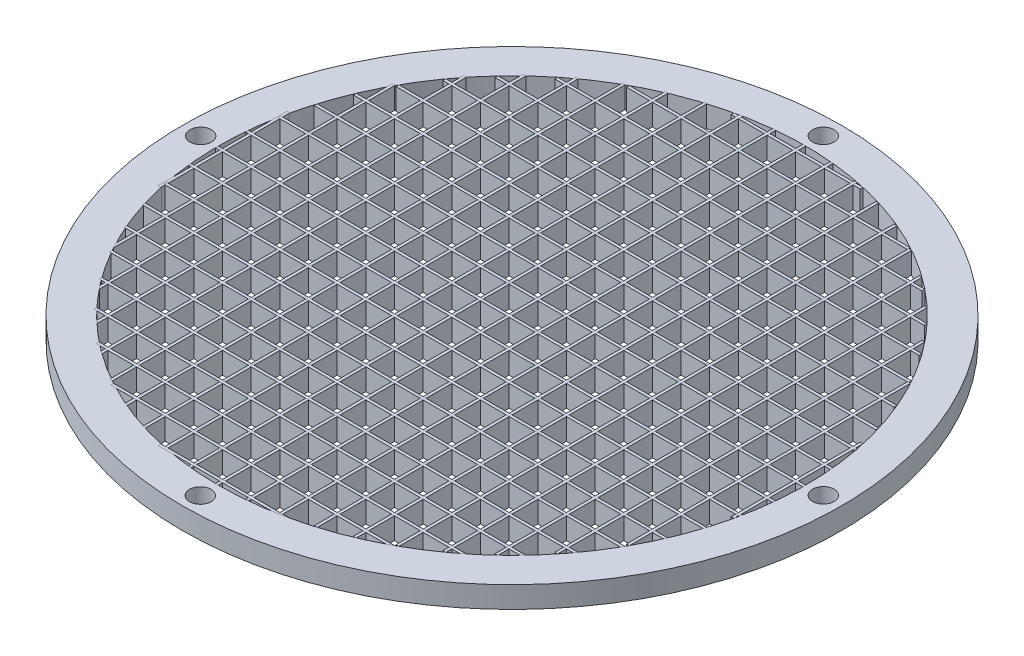
from build123d import *

# Parameters (mm, degrees)
SKETCH2_R              = 46
SKETCH2_R_2            = 41
BOSS_EXTRUDE2_DEPTH    = 3
SKETCH4_W              = 0.4
SKETCH4_H              = 82
EXTRUDE_THIN5_DEPTH    = 3
SKETCH4_H_2            = 81.608823052
EXTRUDE_THIN5_2_DEPTH  = 3
SKETCH4_H_3            = 80.423877052
EXTRUDE_THIN5_3_DEPTH  = 3
SKETCH4_H_4            = 78.409183136
EXTRUDE_THIN5_4_DEPTH  = 3
SKETCH4_H_5            = 75.498344352
EXTRUDE_THIN5_5_DEPTH  = 3
SKETCH4_H_6            = 71.582120672
EXTRUDE_THIN5_6_DEPTH  = 3
SKETCH4_H_7            = 66.483080554
EXTRUDE_THIN5_7_DEPTH  = 3
SKETCH4_H_8            = 59.899916528
EXTRUDE_THIN5_8_DEPTH  = 3
SKETCH4_H_9            = 51.264022472
EXTRUDE_THIN5_9_DEPTH  = 3
SKETCH4_H_10           = 39.24283374
EXTRUDE_THIN5_10_DEPTH = 3
SKETCH4_H_11           = 18
EXTRUDE_THIN5_11_DEPTH = 3
SKETCH4_W_2            = 82
SKETCH4_H_12           = 0.4
EXTRUDE_THIN5_12_DEPTH = 3
EXTRUDE_THIN5_13_DEPTH = 3
EXTRUDE_THIN5_14_DEPTH = 3
EXTRUDE_THIN5_15_DEPTH = 3
EXTRUDE_THIN5_16_DEPTH = 3
EXTRUDE_THIN5_17_DEPTH = 3
EXTRUDE_THIN5_18_DEPTH = 3
EXTRUDE_THIN5_19_DEPTH = 3
EXTRUDE_THIN5_20_DEPTH = 3
EXTRUDE_THIN5_21_DEPTH = 3
EXTRUDE_THIN5_22_DEPTH = 3
SKETCH4_W_3            = 81.608443304
EXTRUDE_THIN5_23_DEPTH = 3
SKETCH4_W_4            = 80.423877052
EXTRUDE_THIN5_24_DEPTH = 3
SKETCH4_W_5            = 78.409183136
EXTRUDE_THIN5_25_DEPTH = 3
SKETCH4_W_6            = 75.498344352
EXTRUDE_THIN5_26_DEPTH = 3
SKETCH4_W_7            = 71.582120672
EXTRUDE_THIN5_27_DEPTH = 3
SKETCH4_W_8            = 66.483080554
EXTRUDE_THIN5_28_DEPTH = 3
SKETCH4_W_9            = 59.899916528
EXTRUDE_THIN5_29_DEPTH = 3
SKETCH4_W_10           = 51.264022472
EXTRUDE_THIN5_30_DEPTH = 3
SKETCH4_W_11           = 39.24283374
EXTRUDE_THIN5_31_DEPTH = 3
SKETCH4_W_12           = 18
EXTRUDE_THIN5_32_DEPTH = 3
EXTRUDE_THIN5_33_DEPTH = 3
EXTRUDE_THIN5_34_DEPTH = 3
EXTRUDE_THIN5_35_DEPTH = 3
EXTRUDE_THIN5_36_DEPTH = 3
EXTRUDE_THIN5_37_DEPTH = 3
EXTRUDE_THIN5_38_DEPTH = 3
EXTRUDE_THIN5_39_DEPTH = 3
EXTRUDE_THIN5_40_DEPTH = 3
EXTRUDE_THIN5_41_DEPTH = 3
EXTRUDE_THIN5_42_DEPTH = 3
SKETCH5_R              = 1.5
CUT_EXTRUDE1_DEPTH     = 3
SKETCH6_R              = 1.5
CUT_EXTRUDE2_DEPTH     = 66.122960621


with BuildPart() as part:
    # Sketch2 → Boss-Extrude2 (new body)
    with BuildSketch(Plane(origin=(0, 0, 0), x_dir=(1, 0, 0), z_dir=(0, 1, 0))):
        Circle(SKETCH2_R)
        Circle(SKETCH2_R_2, mode=Mode.SUBTRACT)
    extrude(amount=BOSS_EXTRUDE2_DEPTH)

    # Sketch5 → Cut-Extrude1 (cut)
    with BuildSketch(Plane.XZ):
        with Locations((0, -43.452428413)):
            Circle(SKETCH5_R)
        with Locations((-43.452428413, 0)):
            Circle(SKETCH5_R)
        with Locations((43.452428413, 0)):
            Circle(SKETCH5_R)
    extrude(amount=-CUT_EXTRUDE1_DEPTH, mode=Mode.SUBTRACT)

    # Sketch6 → Cut-Extrude2 (cut, through all)
    with BuildSketch(Plane(origin=(0, 3, 0), x_dir=(1, 0, 0), z_dir=(0, 1, 0))):
        with Locations((0, -43.5)):
            Circle(SKETCH6_R)
    extrude(amount=-CUT_EXTRUDE2_DEPTH, mode=Mode.SUBTRACT)


with BuildPart() as body_2:
    # Sketch4 → Extrude-Thin5 (new body)
    with BuildSketch(Plane(origin=(0, 3, 0), x_dir=(1, 0, 0), z_dir=(0, 1, 0))):
        with Locations((-0.2, 0)):
            Rectangle(SKETCH4_W, SKETCH4_H)
    extrude(amount=-EXTRUDE_THIN5_DEPTH)


with BuildPart() as body_3:
    # Sketch4 → Extrude-Thin5 2 (new body)
    with BuildSketch(Plane(origin=(0, 3, 0), x_dir=(1, 0, 0), z_dir=(0, 1, 0))):
        with Locations((3.8, 0)):
            Rectangle(SKETCH4_W, SKETCH4_H_2)
    extrude(amount=-EXTRUDE_THIN5_2_DEPTH)


with BuildPart() as body_4:
    # Sketch4 → Extrude-Thin5 3 (new body)
    with BuildSketch(Plane(origin=(0, 3, 0), x_dir=(1, 0, 0), z_dir=(0, 1, 0))):
        with Locations((7.8, 0)):
            Rectangle(SKETCH4_W, SKETCH4_H_3)
    extrude(amount=-EXTRUDE_THIN5_3_DEPTH)


with BuildPart() as body_5:
    # Sketch4 → Extrude-Thin5 4 (new body)
    with BuildSketch(Plane(origin=(0, 3, 0), x_dir=(1, 0, 0), z_dir=(0, 1, 0))):
        with Locations((11.8, 0)):
            Rectangle(SKETCH4_W, SKETCH4_H_4)
    extrude(amount=-EXTRUDE_THIN5_4_DEPTH)


with BuildPart() as body_6:
    # Sketch4 → Extrude-Thin5 5 (new body)
    with BuildSketch(Plane(origin=(0, 3, 0), x_dir=(1, 0, 0), z_dir=(0, 1, 0))):
        with Locations((15.8, 0)):
            Rectangle(SKETCH4_W, SKETCH4_H_5)
    extrude(amount=-EXTRUDE_THIN5_5_DEPTH)


with BuildPart() as body_7:
    # Sketch4 → Extrude-Thin5 6 (new body)
    with BuildSketch(Plane(origin=(0, 3, 0), x_dir=(1, 0, 0), z_dir=(0, 1, 0))):
        with Locations((19.8, 0)):
            Rectangle(SKETCH4_W, SKETCH4_H_6)
    extrude(amount=-EXTRUDE_THIN5_6_DEPTH)


with BuildPart() as body_8:
    # Sketch4 → Extrude-Thin5 7 (new body)
    with BuildSketch(Plane(origin=(0, 3, 0), x_dir=(1, 0, 0), z_dir=(0, 1, 0))):
        with Locations((23.8, 0)):
            Rectangle(SKETCH4_W, SKETCH4_H_7)
    extrude(amount=-EXTRUDE_THIN5_7_DEPTH)


with BuildPart() as body_9:
    # Sketch4 → Extrude-Thin5 8 (new body)
    with BuildSketch(Plane(origin=(0, 3, 0), x_dir=(1, 0, 0), z_dir=(0, 1, 0))):
        with Locations((27.8, 0)):
            Rectangle(SKETCH4_W, SKETCH4_H_8)
    extrude(amount=-EXTRUDE_THIN5_8_DEPTH)


with BuildPart() as body_10:
    # Sketch4 → Extrude-Thin5 9 (new body)
    with BuildSketch(Plane(origin=(0, 3, 0), x_dir=(1, 0, 0), z_dir=(0, 1, 0))):
        with Locations((31.8, 0)):
            Rectangle(SKETCH4_W, SKETCH4_H_9)
    extrude(amount=-EXTRUDE_THIN5_9_DEPTH)


with BuildPart() as body_11:
    # Sketch4 → Extrude-Thin5 10 (new body)
    with BuildSketch(Plane(origin=(0, 3, 0), x_dir=(1, 0, 0), z_dir=(0, 1, 0))):
        with Locations((35.8, 0)):
            Rectangle(SKETCH4_W, SKETCH4_H_10)
    extrude(amount=-EXTRUDE_THIN5_10_DEPTH)


with BuildPart() as body_12:
    # Sketch4 → Extrude-Thin5 11 (new body)
    with BuildSketch(Plane(origin=(0, 3, 0), x_dir=(1, 0, 0), z_dir=(0, 1, 0))):
        with Locations((39.8, 0)):
            Rectangle(SKETCH4_W, SKETCH4_H_11)
    extrude(amount=-EXTRUDE_THIN5_11_DEPTH)


with BuildPart() as body_13:
    # Sketch4 → Extrude-Thin5 12 (new body)
    with BuildSketch(Plane(origin=(0, 3, 0), x_dir=(1, 0, 0), z_dir=(0, 1, 0))):
        with Locations((0, -0.2)):
            Rectangle(SKETCH4_W_2, SKETCH4_H_12)
    extrude(amount=-EXTRUDE_THIN5_12_DEPTH)


with BuildPart() as body_14:
    # Sketch4 → Extrude-Thin5 13 (new body)
    with BuildSketch(Plane(origin=(0, 3, 0), x_dir=(1, 0, 0), z_dir=(0, 1, 0))):
        with Locations((-4.2, 0)):
            Rectangle(SKETCH4_W, SKETCH4_H_2)
    extrude(amount=-EXTRUDE_THIN5_13_DEPTH)


with BuildPart() as body_15:
    # Sketch4 → Extrude-Thin5 14 (new body)
    with BuildSketch(Plane(origin=(0, 3, 0), x_dir=(1, 0, 0), z_dir=(0, 1, 0))):
        with Locations((-8.2, 0)):
            Rectangle(SKETCH4_W, SKETCH4_H_3)
    extrude(amount=-EXTRUDE_THIN5_14_DEPTH)


with BuildPart() as body_16:
    # Sketch4 → Extrude-Thin5 15 (new body)
    with BuildSketch(Plane(origin=(0, 3, 0), x_dir=(1, 0, 0), z_dir=(0, 1, 0))):
        with Locations((-12.2, 0)):
            Rectangle(SKETCH4_W, SKETCH4_H_4)
    extrude(amount=-EXTRUDE_THIN5_15_DEPTH)


with BuildPart() as body_17:
    # Sketch4 → Extrude-Thin5 16 (new body)
    with BuildSketch(Plane(origin=(0, 3, 0), x_dir=(1, 0, 0), z_dir=(0, 1, 0))):
        with Locations((-16.2, 0)):
            Rectangle(SKETCH4_W, SKETCH4_H_5)
    extrude(amount=-EXTRUDE_THIN5_16_DEPTH)


with BuildPart() as body_18:
    # Sketch4 → Extrude-Thin5 17 (new body)
    with BuildSketch(Plane(origin=(0, 3, 0), x_dir=(1, 0, 0), z_dir=(0, 1, 0))):
        with Locations((-20.2, 0)):
            Rectangle(SKETCH4_W, SKETCH4_H_6)
    extrude(amount=-EXTRUDE_THIN5_17_DEPTH)


with BuildPart() as body_19:
    # Sketch4 → Extrude-Thin5 18 (new body)
    with BuildSketch(Plane(origin=(0, 3, 0), x_dir=(1, 0, 0), z_dir=(0, 1, 0))):
        with Locations((-24.2, 0)):
            Rectangle(SKETCH4_W, SKETCH4_H_7)
    extrude(amount=-EXTRUDE_THIN5_18_DEPTH)


with BuildPart() as body_20:
    # Sketch4 → Extrude-Thin5 19 (new body)
    with BuildSketch(Plane(origin=(0, 3, 0), x_dir=(1, 0, 0), z_dir=(0, 1, 0))):
        with Locations((-28.2, 0)):
            Rectangle(SKETCH4_W, SKETCH4_H_8)
    extrude(amount=-EXTRUDE_THIN5_19_DEPTH)


with BuildPart() as body_21:
    # Sketch4 → Extrude-Thin5 20 (new body)
    with BuildSketch(Plane(origin=(0, 3, 0), x_dir=(1, 0, 0), z_dir=(0, 1, 0))):
        with Locations((-32.2, 0)):
            Rectangle(SKETCH4_W, SKETCH4_H_9)
    extrude(amount=-EXTRUDE_THIN5_20_DEPTH)


with BuildPart() as body_22:
    # Sketch4 → Extrude-Thin5 21 (new body)
    with BuildSketch(Plane(origin=(0, 3, 0), x_dir=(1, 0, 0), z_dir=(0, 1, 0))):
        with Locations((-36.2, 0)):
            Rectangle(SKETCH4_W, SKETCH4_H_10)
    extrude(amount=-EXTRUDE_THIN5_21_DEPTH)


with BuildPart() as body_23:
    # Sketch4 → Extrude-Thin5 22 (new body)
    with BuildSketch(Plane(origin=(0, 3, 0), x_dir=(1, 0, 0), z_dir=(0, 1, 0))):
        with Locations((-40.2, 0)):
            Rectangle(SKETCH4_W, SKETCH4_H_11)
    extrude(amount=-EXTRUDE_THIN5_22_DEPTH)


with BuildPart() as body_24:
    # Sketch4 → Extrude-Thin5 23 (new body)
    with BuildSketch(Plane(origin=(0, 3, 0), x_dir=(1, 0, 0), z_dir=(0, 1, 0))):
        with Locations((0, -4.2)):
            Rectangle(SKETCH4_W_3, SKETCH4_H_12)
    extrude(amount=-EXTRUDE_THIN5_23_DEPTH)


with BuildPart() as body_25:
    # Sketch4 → Extrude-Thin5 24 (new body)
    with BuildSketch(Plane(origin=(0, 3, 0), x_dir=(1, 0, 0), z_dir=(0, 1, 0))):
        with Locations((0, -8.2)):
            Rectangle(SKETCH4_W_4, SKETCH4_H_12)
    extrude(amount=-EXTRUDE_THIN5_24_DEPTH)


with BuildPart() as body_26:
    # Sketch4 → Extrude-Thin5 25 (new body)
    with BuildSketch(Plane(origin=(0, 3, 0), x_dir=(1, 0, 0), z_dir=(0, 1, 0))):
        with Locations((0, -12.2)):
            Rectangle(SKETCH4_W_5, SKETCH4_H_12)
    extrude(amount=-EXTRUDE_THIN5_25_DEPTH)


with BuildPart() as body_27:
    # Sketch4 → Extrude-Thin5 26 (new body)
    with BuildSketch(Plane(origin=(0, 3, 0), x_dir=(1, 0, 0), z_dir=(0, 1, 0))):
        with Locations((0, -16.2)):
            Rectangle(SKETCH4_W_6, SKETCH4_H_12)
    extrude(amount=-EXTRUDE_THIN5_26_DEPTH)


with BuildPart() as body_28:
    # Sketch4 → Extrude-Thin5 27 (new body)
    with BuildSketch(Plane(origin=(0, 3, 0), x_dir=(1, 0, 0), z_dir=(0, 1, 0))):
        with Locations((0, -20.2)):
            Rectangle(SKETCH4_W_7, SKETCH4_H_12)
    extrude(amount=-EXTRUDE_THIN5_27_DEPTH)


with BuildPart() as body_29:
    # Sketch4 → Extrude-Thin5 28 (new body)
    with BuildSketch(Plane(origin=(0, 3, 0), x_dir=(1, 0, 0), z_dir=(0, 1, 0))):
        with Locations((0, -24.2)):
            Rectangle(SKETCH4_W_8, SKETCH4_H_12)
    extrude(amount=-EXTRUDE_THIN5_28_DEPTH)


with BuildPart() as body_30:
    # Sketch4 → Extrude-Thin5 29 (new body)
    with BuildSketch(Plane(origin=(0, 3, 0), x_dir=(1, 0, 0), z_dir=(0, 1, 0))):
        with Locations((0, -28.2)):
            Rectangle(SKETCH4_W_9, SKETCH4_H_12)
    extrude(amount=-EXTRUDE_THIN5_29_DEPTH)


with BuildPart() as body_31:
    # Sketch4 → Extrude-Thin5 30 (new body)
    with BuildSketch(Plane(origin=(0, 3, 0), x_dir=(1, 0, 0), z_dir=(0, 1, 0))):
        with Locations((0, -32.2)):
            Rectangle(SKETCH4_W_10, SKETCH4_H_12)
    extrude(amount=-EXTRUDE_THIN5_30_DEPTH)


with BuildPart() as body_32:
    # Sketch4 → Extrude-Thin5 31 (new body)
    with BuildSketch(Plane(origin=(0, 3, 0), x_dir=(1, 0, 0), z_dir=(0, 1, 0))):
        with Locations((0, -36.2)):
            Rectangle(SKETCH4_W_11, SKETCH4_H_12)
    extrude(amount=-EXTRUDE_THIN5_31_DEPTH)


with BuildPart() as body_33:
    # Sketch4 → Extrude-Thin5 32 (new body)
    with BuildSketch(Plane(origin=(0, 3, 0), x_dir=(1, 0, 0), z_dir=(0, 1, 0))):
        with Locations((0, -40.2)):
            Rectangle(SKETCH4_W_12, SKETCH4_H_12)
    extrude(amount=-EXTRUDE_THIN5_32_DEPTH)


with BuildPart() as body_34:
    # Sketch4 → Extrude-Thin5 33 (new body)
    with BuildSketch(Plane(origin=(0, 3, 0), x_dir=(1, 0, 0), z_dir=(0, 1, 0))):
        with Locations((0, 39.8)):
            Rectangle(SKETCH4_W_12, SKETCH4_H_12)
    extrude(amount=-EXTRUDE_THIN5_33_DEPTH)


with BuildPart() as body_35:
    # Sketch4 → Extrude-Thin5 34 (new body)
    with BuildSketch(Plane(origin=(0, 3, 0), x_dir=(1, 0, 0), z_dir=(0, 1, 0))):
        with Locations((0, 35.8)):
            Rectangle(SKETCH4_W_11, SKETCH4_H_12)
    extrude(amount=-EXTRUDE_THIN5_34_DEPTH)


with BuildPart() as body_36:
    # Sketch4 → Extrude-Thin5 35 (new body)
    with BuildSketch(Plane(origin=(0, 3, 0), x_dir=(1, 0, 0), z_dir=(0, 1, 0))):
        with Locations((0, 31.8)):
            Rectangle(SKETCH4_W_10, SKETCH4_H_12)
    extrude(amount=-EXTRUDE_THIN5_35_DEPTH)


with BuildPart() as body_37:
    # Sketch4 → Extrude-Thin5 36 (new body)
    with BuildSketch(Plane(origin=(0, 3, 0), x_dir=(1, 0, 0), z_dir=(0, 1, 0))):
        with Locations((0, 27.8)):
            Rectangle(SKETCH4_W_9, SKETCH4_H_12)
    extrude(amount=-EXTRUDE_THIN5_36_DEPTH)


with BuildPart() as body_38:
    # Sketch4 → Extrude-Thin5 37 (new body)
    with BuildSketch(Plane(origin=(0, 3, 0), x_dir=(1, 0, 0), z_dir=(0, 1, 0))):
        with Locations((0, 23.8)):
            Rectangle(SKETCH4_W_8, SKETCH4_H_12)
    extrude(amount=-EXTRUDE_THIN5_37_DEPTH)


with BuildPart() as body_39:
    # Sketch4 → Extrude-Thin5 38 (new body)
    with BuildSketch(Plane(origin=(0, 3, 0), x_dir=(1, 0, 0), z_dir=(0, 1, 0))):
        with Locations((0, 19.8)):
            Rectangle(SKETCH4_W_7, SKETCH4_H_12)
    extrude(amount=-EXTRUDE_THIN5_38_DEPTH)


with BuildPart() as body_40:
    # Sketch4 → Extrude-Thin5 39 (new body)
    with BuildSketch(Plane(origin=(0, 3, 0), x_dir=(1, 0, 0), z_dir=(0, 1, 0))):
        with Locations((0, 15.8)):
            Rectangle(SKETCH4_W_6, SKETCH4_H_12)
    extrude(amount=-EXTRUDE_THIN5_39_DEPTH)


with BuildPart() as body_41:
    # Sketch4 → Extrude-Thin5 40 (new body)
    with BuildSketch(Plane(origin=(0, 3, 0), x_dir=(1, 0, 0), z_dir=(0, 1, 0))):
        with Locations((0, 11.8)):
            Rectangle(SKETCH4_W_5, SKETCH4_H_12)
    extrude(amount=-EXTRUDE_THIN5_40_DEPTH)


with BuildPart() as body_42:
    # Sketch4 → Extrude-Thin5 41 (new body)
    with BuildSketch(Plane(origin=(0, 3, 0), x_dir=(1, 0, 0), z_dir=(0, 1, 0))):
        with Locations((0, 7.8)):
            Rectangle(SKETCH4_W_4, SKETCH4_H_12)
    extrude(amount=-EXTRUDE_THIN5_41_DEPTH)


with BuildPart() as body_43:
    # Sketch4 → Extrude-Thin5 42 (new body)
    with BuildSketch(Plane(origin=(0, 3, 0), x_dir=(1, 0, 0), z_dir=(0, 1, 0))):
        with Locations((0, 3.8)):
            Rectangle(SKETCH4_W_3, SKETCH4_H_12)
    extrude(amount=-EXTRUDE_THIN5_42_DEPTH)


solid = Compound([part.part, body_2.part, body_3.part, body_4.part, body_5.part, body_6.part, body_7.part, body_8.part, body_9.part, body_10.part, body_11.part, body_12.part, body_13.part, body_14.part, body_15.part, body_16.part, body_17.part, body_18.part, body_19.part, body_20.part, body_21.part, body_22.part, body_23.part, body_24.part, body_25.part, body_26.part, body_27.part, body_28.part, body_29.part, body_30.part, body_31.part, body_32.part, body_33.part, body_34.part, body_35.part, body_36.part, body_37.part, body_38.part, body_39.part, body_40.part, body_41.part, body_42.part, body_43.part])
